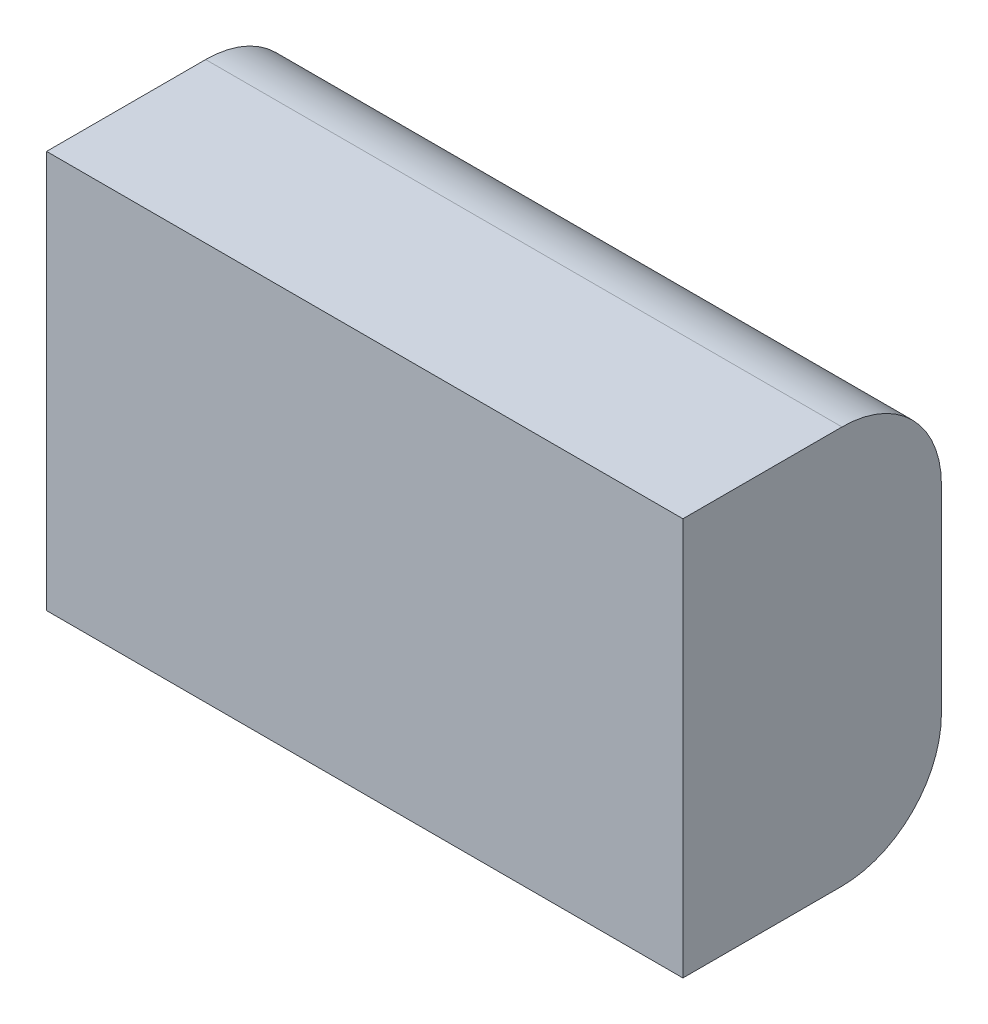
from build123d import *

# Parameters (mm, degrees)
BOSS_EXTRUDE1_DEPTH = 101.6


with BuildPart() as part:
    # Sketch1 → Boss-Extrude1 (new, symmetric)
    with BuildSketch(Plane(origin=(0, 0, 0), x_dir=(0, 0, -1), z_dir=(1, 0, 0))):
        with BuildLine():
            Line((49.373646209, 66.02166065), (-1.426353791, 66.02166065))
            Line((-1.426353791, 66.02166065), (-1.426353791, -60.97833935))
            Line((-1.426353791, -60.97833935), (49.373646209, -60.97833935))
            ThreePointArc((49.373646209, -60.97833935), (71.824286512, -51.678979653), (81.123646209, -29.22833935))
            Line((81.123646209, -29.22833935), (81.123646209, 34.27166065))
            ThreePointArc((81.123646209, 34.27166065), (71.824286512, 56.722300952), (49.373646209, 66.02166065))
        make_face()
    extrude(amount=BOSS_EXTRUDE1_DEPTH, both=True)


solid = part.part
